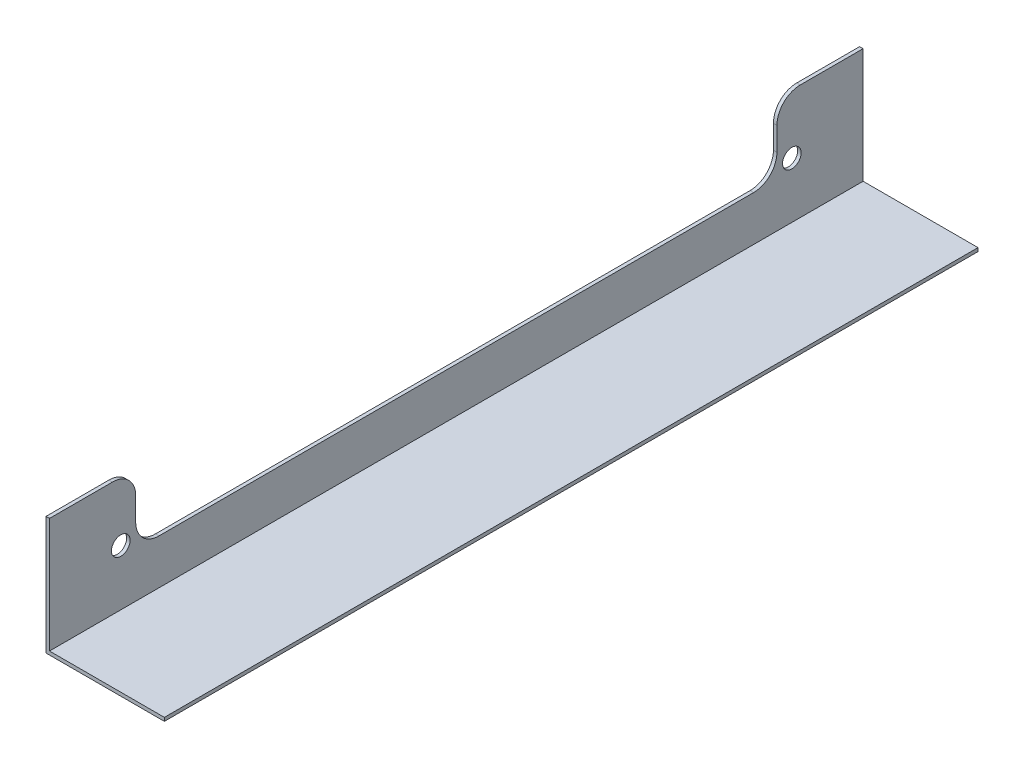
from build123d import *

# Parameters (mm, degrees)
SALIENTE_EXTRUIR1_DEPTH    = 349.2
CROQUIS2_R                 = 4
CORTAR_EXTRUIR1_DEPTH      = 2
CORTAR_EXTRUIR2_DEPTH      = 357.513562154
CORTAR_EXTRUIR2_DEPTH_BACK = 2
REDONDEO1_R                = 10


with BuildPart() as part:
    # Croquis1 → Saliente-Extruir1 (new body)
    with BuildSketch(Plane.XY):
        Polygon((0, 0), (0, 50.8), (1.5, 50.8), (1.5, 1.5), (50.8, 1.5), (50.8, 0), align=None)
    extrude(amount=SALIENTE_EXTRUIR1_DEPTH)

    # Croquis2 → Cortar-Extruir1 (cut)
    with BuildSketch(Plane.ZY):
        with Locations((126.6, 25.4)):
            Circle(CROQUIS2_R)
        with Locations((222.6, 25.4)):
            Circle(CROQUIS2_R)
        with Locations((30.6, 25.4)):
            Circle(CROQUIS2_R)
        with Locations((318.6, 25.4)):
            Circle(CROQUIS2_R)
    extrude(amount=-CORTAR_EXTRUIR1_DEPTH, mode=Mode.SUBTRACT)

    # Croquis5 → Cortar-Extruir2 (cut, two sides: drawn at the far end of the back side and taken through both)
    with BuildSketch(Plane.ZY.offset(-CORTAR_EXTRUIR2_DEPTH_BACK)):
        Polygon((312.2, 693.411982182), (312.2, 50.8), (312.2, 20.8), (37, 20.8), (37, 50.8), (37, 693.411982182), (37, 1978.635946545), (312.2, 1978.635946545), align=None)
    extrude(amount=CORTAR_EXTRUIR2_DEPTH + CORTAR_EXTRUIR2_DEPTH_BACK, mode=Mode.SUBTRACT)

    # Redondeo1
    redondeo1_edges = [part.edges().sort_by_distance(p)[0] for p in [
        (0.75, 50.8, 37),
        (0.75, 20.8, 37),
        (0.75, 50.8, 312.2),
        (0.75, 20.8, 312.2),
    ]]
    fillet(redondeo1_edges, radius=REDONDEO1_R)


solid = part.part
